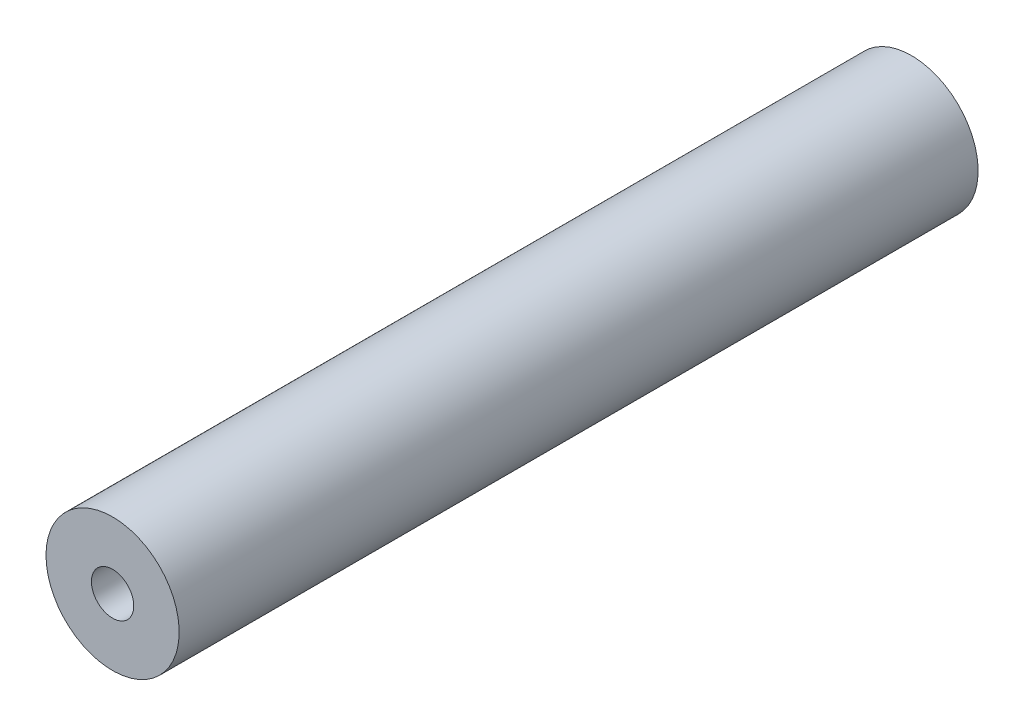
from build123d import *

# Parameters (mm, degrees)
SKETCH1_R                            = 6.35
BOSS_EXTRUDE1_DEPTH                  = 38.1
F_10_32_TAPPED_HOLE1_D               = 4.0386
F_10_32_TAPPED_HOLE1_DEPTH           = 12.02944
F_10_32_TAPPED_HOLE1_TIP             = 1.213317848
F_10_32_TAPPED_HOLE1_ON_FACE_2_D     = 4.0386
F_10_32_TAPPED_HOLE1_ON_FACE_2_DEPTH = 12.02944
F_10_32_TAPPED_HOLE1_ON_FACE_2_TIP   = 1.213317848


with BuildPart() as part:
    # Sketch1 → Boss-Extrude1 (new, symmetric)
    with BuildSketch(Plane.XY):
        Circle(SKETCH1_R)
    extrude(amount=BOSS_EXTRUDE1_DEPTH, both=True)

    # #10-32 Tapped Hole1
    with Locations(Plane(origin=(0, 0, -38.1), x_dir=(-1, 0, 0), z_dir=(0, 0, -1))):
        with Locations((0, 0)):
            Hole(F_10_32_TAPPED_HOLE1_D / 2, depth=F_10_32_TAPPED_HOLE1_DEPTH)
            with Locations((0, 0, -(F_10_32_TAPPED_HOLE1_DEPTH + F_10_32_TAPPED_HOLE1_TIP / 2))):  # 118° drill point
                Cone(0, F_10_32_TAPPED_HOLE1_D / 2, F_10_32_TAPPED_HOLE1_TIP, mode=Mode.SUBTRACT)

    # #10-32 Tapped Hole1 on face 2
    with Locations(Plane.XY.offset(38.1)):
        with Locations((0, 0)):
            Hole(F_10_32_TAPPED_HOLE1_ON_FACE_2_D / 2, depth=F_10_32_TAPPED_HOLE1_ON_FACE_2_DEPTH)
            with Locations((0, 0, -(F_10_32_TAPPED_HOLE1_ON_FACE_2_DEPTH + F_10_32_TAPPED_HOLE1_ON_FACE_2_TIP / 2))):  # 118° drill point
                Cone(0, F_10_32_TAPPED_HOLE1_ON_FACE_2_D / 2, F_10_32_TAPPED_HOLE1_ON_FACE_2_TIP, mode=Mode.SUBTRACT)


solid = part.part
